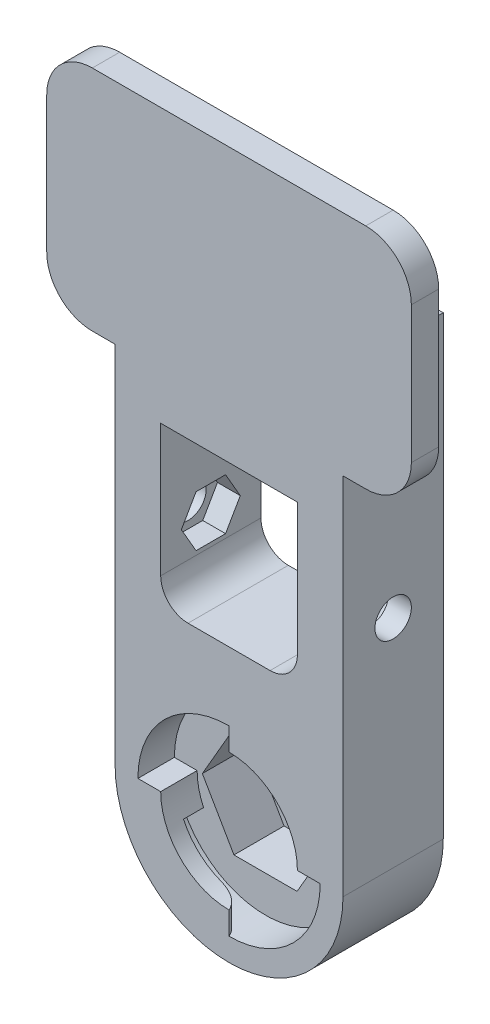
from build123d import *

# Parameters (mm, degrees)
SKETCH1_R           = 12.5
BOSS_EXTRUDE1_DEPTH = 10
SKETCH2_R           = 12.5
SKETCH2_R_2         = 5
BOSS_EXTRUDE2_DEPTH = 1.5
CUT_EXTRUDE3_START  = -3
SKETCH3_R           = 12.5
CUT_EXTRUDE3_DEPTH  = 3
SKETCH4_R           = 12.5
SKETCH4_R_2         = 7.5
BOSS_EXTRUDE3_DEPTH = 4
CUT_EXTRUDE4_START  = -4
SKETCH5_R           = 10
SKETCH5_R_2         = 7.5
CUT_EXTRUDE4_DEPTH  = 4
BOSS_EXTRUDE4_DEPTH = 4
BOSS_EXTRUDE5_START = -1.8
BOSS_EXTRUDE5_DEPTH = 1.8
FILLET1_R           = 3
BOSS_EXTRUDE6_START = -11
BOSS_EXTRUDE6_DEPTH = 11
CUT_EXTRUDE5_DEPTH  = 12.5
CUT_EXTRUDE6_DEPTH  = 2.5
CUT_EXTRUDE7_DEPTH  = 40.080046087
SKETCH12_R          = 2
CUT_EXTRUDE8_DEPTH  = 38.696153679
CUT_EXTRUDE9_DEPTH  = 2.5
FILLET2_R           = 3
SKETCH14_W          = 5
SKETCH14_H          = 11
BOSS_EXTRUDE7_DEPTH = 20
SKETCH15_W          = 15
SKETCH15_H          = 15
BOSS_EXTRUDE8_DEPTH = 3
SKETCH16_W          = 7.5
SKETCH16_H          = 5
CUT_EXTRUDE10_DEPTH = 3
FILLET3_R           = 5


with BuildPart() as part:
    # Sketch1 → Boss-Extrude1 (new body)
    with BuildSketch(Plane.XY):
        Circle(SKETCH1_R)
        Polygon((3.464101615, -6), (6.92820323, 0), (3.464101615, 6), (-3.464101615, 6), (-6.92820323, 0), (-3.464101615, -6), align=None, mode=Mode.SUBTRACT)
    extrude(amount=BOSS_EXTRUDE1_DEPTH)

    # Sketch2 → Boss-Extrude2 (add)
    with BuildSketch(Plane(origin=(0, 0, 0), x_dir=(-1, 0, 0), z_dir=(0, 0, -1))):
        with Locations(Location((0, 0, 0), (0, 0, 180))):
            Circle(SKETCH2_R)
        Circle(SKETCH2_R_2, mode=Mode.SUBTRACT)
    extrude(amount=-BOSS_EXTRUDE2_DEPTH)

    # Sketch3 → Cut-Extrude3 (cut)
    with BuildSketch(Plane.XY.offset(10).offset(CUT_EXTRUDE3_START)):
        Circle(SKETCH3_R)
    extrude(amount=CUT_EXTRUDE3_DEPTH, mode=Mode.SUBTRACT)

    # Sketch4 → Boss-Extrude3 (add)
    with BuildSketch(Plane.XY.offset(7)):
        Circle(SKETCH4_R)
        Circle(SKETCH4_R_2, mode=Mode.SUBTRACT)
    extrude(amount=BOSS_EXTRUDE3_DEPTH)

    # Sketch5 → Cut-Extrude4 (cut)
    with BuildSketch(Plane.XY.offset(11).offset(CUT_EXTRUDE4_START)):
        Circle(SKETCH5_R)
        Circle(SKETCH5_R_2, mode=Mode.SUBTRACT)
    extrude(amount=CUT_EXTRUDE4_DEPTH, mode=Mode.SUBTRACT)

    # Sketch6 → Boss-Extrude4 (add)
    with BuildSketch(Plane.XY.offset(7)):
        with BuildLine():
            ThreePointArc((-6.797308403, -3.169636963), (-7.322220053, -1.623297105), (-7.5, 0))
            Line((-7.5, 0), (-10, 0))
            ThreePointArc((-10, 0), (-9.762960071, -2.164396139), (-9.06307787, -4.226182617))
            Line((-9.06307787, -4.226182617), (-6.797308403, -3.169636963))
        make_face()
        with BuildLine():
            ThreePointArc((6.797308403, 3.169636963), (7.322220053, 1.623297105), (7.5, 0))
            Line((7.5, 0), (10, 0))
            ThreePointArc((10, 0), (9.762960071, 2.164396139), (9.06307787, 4.226182617))
            Line((9.06307787, 4.226182617), (6.797308403, 3.169636963))
        make_face()
    extrude(amount=BOSS_EXTRUDE4_DEPTH)

    # Sketch7 → Boss-Extrude5 (add)
    with BuildSketch(Plane.XY.offset(11).offset(BOSS_EXTRUDE5_START)):
        with BuildLine():
            Line((0, 10), (0, 7.5))
            ThreePointArc((0, 7.5), (4.029747063, 6.325435844), (6.797308403, 3.169636963))
            Line((6.797308403, 3.169636963), (9.06307787, 4.226182617))
            ThreePointArc((9.06307787, 4.226182617), (5.372996083, 8.433914458), (0, 10))
        make_face()
        with BuildLine():
            Line((0, -10), (0, -7.5))
            ThreePointArc((0, -7.5), (-4.029747063, -6.325435844), (-6.797308403, -3.169636963))
            Line((-6.797308403, -3.169636963), (-9.06307787, -4.226182617))
            ThreePointArc((-9.06307787, -4.226182617), (-5.372996083, -8.433914458), (0, -10))
        make_face()
    extrude(amount=BOSS_EXTRUDE5_DEPTH)

    # Fillet1
    # the kernel refuses this fillet: 3 mm, written as the material it takes off along each edge
    with BuildSketch(Plane(origin=(0, 16.873863542, 9.2), x_dir=(1, 0, 0), z_dir=(0, -1, 0))) as fillet1_piece_1_section:
        with BuildLine():
            CenterArc((2.749545417, 3), FILLET1_R, 203.578178478, 66.421821522)
            Line((0, 1.8), (0, 0))
            Line((0, 0), (2.749545417, 0))
        make_face()
    fillet1_piece_1 = extrude(amount=16.247727085, mode=Mode.PRIVATE)
    fillet1_piece_1 = fillet1_piece_1 & Plane(origin=(0, 0, 9.68499996), x_dir=(1, 0, 0), z_dir=(0, 0, -1)) * Cylinder(10, 44, mode=Mode.PRIVATE)
    add(fillet1_piece_1, mode=Mode.SUBTRACT)
    with BuildSketch(Plane(origin=(0, -16.873863542, 9.2), x_dir=(-1, 0, 0), z_dir=(0, 1, 0))) as fillet1_piece_2_section:
        with BuildLine():
            CenterArc((2.749545417, 3), FILLET1_R, 203.578178478, 66.421821522)
            Line((0, 1.8), (0, 0))
            Line((0, 0), (2.749545417, 0))
        make_face()
    fillet1_piece_2 = extrude(amount=16.247727085, mode=Mode.PRIVATE)
    fillet1_piece_2 = fillet1_piece_2 & Plane(origin=(0, 0, 9.68499996), x_dir=(1, 0, 0), z_dir=(0, 0, -1)) * Cylinder(10, 44, mode=Mode.PRIVATE)
    add(fillet1_piece_2, mode=Mode.SUBTRACT)

    # Sketch8 → Boss-Extrude6 (add)
    with BuildSketch(Plane.XY.offset(11).offset(BOSS_EXTRUDE6_START)):
        with BuildLine():
            Line((12.5, 0), (12.5, 30))
            Line((12.5, 30), (-12.5, 30))
            Line((-12.5, 30), (-12.5, 0))
            ThreePointArc((-12.5, 0), (0, 12.5), (12.5, 0))
        make_face()
    extrude(amount=BOSS_EXTRUDE6_DEPTH)

    # Sketch9 → Cut-Extrude5 (cut)
    with BuildSketch(Plane(origin=(0, 30, 0), x_dir=(1, 0, 0), z_dir=(0, 1, 0))):
        Polygon((-7.5, 0), (-7.5, -5.5), (-7.5, -11), (7.5, -11), (7.5, -5.5), (7.5, 0), align=None)
    extrude(amount=-CUT_EXTRUDE5_DEPTH, mode=Mode.SUBTRACT)

    # Sketch10 → Cut-Extrude6 (cut)
    with BuildSketch(Plane(origin=(-7.5, 0, 0), x_dir=(0, 0, -1), z_dir=(1, 0, 0))):
        Polygon((-3.883419246, 26.55), (-5.5, 26.55), (-5.5, 20.95), (-3.883419246, 20.95), (-2.266838493, 23.75), align=None)
        Polygon((-5.5, 20.95), (-5.5, 26.55), (-7.116580754, 26.55), (-8.733161507, 23.75), (-7.116580754, 20.95), align=None)
    extrude(amount=-CUT_EXTRUDE6_DEPTH, mode=Mode.SUBTRACT)

    # Sketch11 → Cut-Extrude7 (cut, through all)
    with BuildSketch(Plane(origin=(-10, 0, 0), x_dir=(0, 0, -1), z_dir=(1, 0, 0))):
        with BuildLine():
            ThreePointArc((-3.5, 23.75), (-4.085786438, 25.164213562), (-5.5, 25.75))
            Line((-5.5, 25.75), (-5.5, 21.75))
            ThreePointArc((-5.5, 21.75), (-4.085786438, 22.335786438), (-3.5, 23.75))
        make_face()
        with BuildLine():
            Line((-5.5, 21.75), (-5.5, 25.75))
            ThreePointArc((-5.5, 25.75), (-7.5, 23.75), (-5.5, 21.75))
        make_face()
    extrude(amount=-CUT_EXTRUDE7_DEPTH, mode=Mode.SUBTRACT)

    # Sketch12 → Cut-Extrude8 (cut, through all)
    with BuildSketch(Plane.ZY.offset(-7.5)):
        with Locations(Location((5.5, 23.75, 0), (0, 0, 180))):
            Circle(SKETCH12_R)
    extrude(amount=-CUT_EXTRUDE8_DEPTH, mode=Mode.SUBTRACT)

    # Sketch13 → Cut-Extrude9 (cut)
    with BuildSketch(Plane.ZY.offset(-7.5)):
        Polygon((8.733161507, 23.75), (7.116580754, 26.55), (3.883419246, 26.55), (2.266838493, 23.75), (3.883419246, 20.95), (7.116580754, 20.95), align=None)
    extrude(amount=-CUT_EXTRUDE9_DEPTH, mode=Mode.SUBTRACT)

    # Fillet2
    fillet2_edges = [part.edges().sort_by_distance(p)[0] for p in [
        (-7.5, 17.5, 5.5),
        (7.5, 17.5, 5.5),
    ]]
    fillet(fillet2_edges, radius=FILLET2_R)

    # Sketch14 → Boss-Extrude7 (add)
    with BuildSketch(Plane(origin=(0, 30, 0), x_dir=(1, 0, 0), z_dir=(0, 1, 0))):
        with Locations((10, -5.5)):
            Rectangle(SKETCH14_W, SKETCH14_H)
        with Locations((-10, -5.5)):
            Rectangle(SKETCH14_W, SKETCH14_H)
    extrude(amount=BOSS_EXTRUDE7_DEPTH)

    # Sketch15 → Boss-Extrude8 (add)
    with BuildSketch(Plane.XY.offset(11)):
        with Locations((0, 42.5)):
            Rectangle(SKETCH15_W, SKETCH15_H)
        Polygon((-12.5, 50), (-7.5, 50), (7.5, 50), (12.5, 50), (12.5, 35), (20, 35), (20, 65), (-20, 65), (-20, 35), (-12.5, 35), align=None)
    extrude(amount=-BOSS_EXTRUDE8_DEPTH)

    # Sketch16 → Cut-Extrude10 (cut)
    with BuildSketch(Plane.XY.offset(11)):
        with Locations((16.25, 37.5)):
            Rectangle(SKETCH16_W, SKETCH16_H)
        with Locations((-16.25, 37.5)):
            Rectangle(SKETCH16_W, SKETCH16_H)
    extrude(amount=-CUT_EXTRUDE10_DEPTH, mode=Mode.SUBTRACT)

    # Fillet3
    fillet3_edges = [part.edges().sort_by_distance(p)[0] for p in [
        (-20, 65, 9.5),
        (20, 65, 9.5),
        (20, 40, 9.5),
        (-20, 40, 9.5),
    ]]
    fillet(fillet3_edges, radius=FILLET3_R)


solid = part.part
